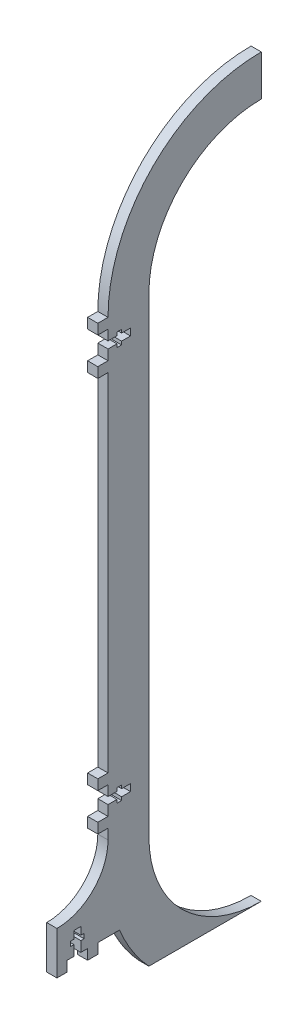
from build123d import *

# Parameters (mm, degrees)
BOSS_EXTRUDE2_DEPTH = 6.35


with BuildPart() as part:
    # Elevator Ball Support Rail → Boss-Extrude2 (new body)
    with BuildSketch(Plane(origin=(0, 0, 0), x_dir=(0, 0, -1), z_dir=(1, 0, 0))):
        with BuildLine():
            ThreePointArc((0, 146.05), (20.458591334, 195.441408666), (69.85, 215.9))
            Line((69.85, 215.9), (69.85, 241.3))
            ThreePointArc((69.85, 241.3), (2.498079092, 213.401920908), (-25.4, 146.05))
            Line((-25.4, 146.05), (-31.75, 146.05))
            Line((-31.75, 146.05), (-31.75, 139.7))
            Line((-31.75, 139.7), (-25.4, 139.7))
            Line((-25.4, 139.7), (-25.4, 133.35))
            Line((-25.4, 133.35), (-19.865000021, 133.35))
            Line((-19.865000021, 133.35), (-19.865000021, 135.390999982))
            Line((-19.865000021, 135.390999982), (-16.964999979, 135.390999982))
            Line((-16.964999979, 135.390999982), (-16.964999979, 133.35))
            Line((-16.964999979, 133.35), (-11.43, 133.35))
            Line((-11.43, 133.35), (-11.43, 129.032))
            Line((-11.43, 129.032), (-16.964999979, 129.032))
            Line((-16.964999979, 129.032), (-16.964999979, 126.991000018))
            Line((-16.964999979, 126.991000018), (-19.865000021, 126.991000018))
            Line((-19.865000021, 126.991000018), (-19.865000021, 129.032))
            Line((-19.865000021, 129.032), (-25.4, 129.032))
            Line((-25.4, 129.032), (-25.4, 122.682))
            Line((-25.4, 122.682), (-31.75, 122.682))
            Line((-31.75, 122.682), (-31.75, 116.332))
            Line((-31.75, 116.332), (-25.4, 116.332))
            Line((-25.4, 116.332), (-25.4, -99.187))
            Line((-25.4, -99.187), (-31.75, -99.187))
            Line((-31.75, -99.187), (-31.75, -105.537))
            Line((-31.75, -105.537), (-25.4, -105.537))
            Line((-25.4, -105.537), (-25.4, -111.887))
            Line((-25.4, -111.887), (-19.865000021, -111.887))
            Line((-19.865000021, -111.887), (-19.865000021, -109.846000018))
            Line((-19.865000021, -109.846000018), (-16.964999979, -109.846000018))
            Line((-16.964999979, -109.846000018), (-16.964999979, -111.887))
            Line((-16.964999979, -111.887), (-11.43, -111.887))
            Line((-11.43, -111.887), (-11.43, -116.205))
            Line((-11.43, -116.205), (-16.964999979, -116.205))
            Line((-16.964999979, -116.205), (-16.964999979, -118.245999982))
            Line((-16.964999979, -118.245999982), (-19.865000021, -118.245999982))
            Line((-19.865000021, -118.245999982), (-19.865000021, -116.205))
            Line((-19.865000021, -116.205), (-25.4, -116.205))
            Line((-25.4, -116.205), (-25.4, -122.555))
            Line((-25.4, -122.555), (-31.75, -122.555))
            Line((-31.75, -122.555), (-31.75, -128.905))
            Line((-31.75, -128.905), (-25.4, -128.905))
            Line((-25.4, -128.905), (-25.4, -135.255))
            ThreePointArc((-25.4, -135.255), (-34.699359697, -157.705640303), (-57.15, -167.005))
            Line((-57.15, -167.005), (-57.15, -193.675))
            Line((-57.15, -193.675), (-50.8, -193.675))
            Line((-50.8, -193.675), (-50.8, -187.325))
            Line((-50.8, -187.325), (-46.609, -187.325))
            Line((-46.609, -187.325), (-46.609, -180.975))
            Line((-46.609, -180.975), (-48.649999982, -180.975))
            Line((-48.649999982, -180.975), (-48.649999982, -178.074999958))
            Line((-48.649999982, -178.074999958), (-46.609, -178.074999958))
            Line((-46.609, -178.074999958), (-46.609, -173.355))
            Line((-46.609, -173.355), (-42.291, -173.355))
            Line((-42.291, -173.355), (-42.291, -178.074999958))
            Line((-42.291, -178.074999958), (-40.250000018, -178.074999958))
            Line((-40.250000018, -178.074999958), (-40.250000018, -180.975))
            Line((-40.250000018, -180.975), (-42.291, -180.975))
            Line((-42.291, -180.975), (-42.291, -187.325))
            Line((-42.291, -187.325), (-38.1, -187.325))
            Line((-38.1, -187.325), (-38.1, -193.675))
            Line((-38.1, -193.675), (-31.75, -193.675))
            Line((-31.75, -193.675), (-31.75, -187.325))
            Line((-31.75, -187.325), (-18.260077364, -187.325))
            ThreePointArc((-18.260077364, -187.325), (-10.411940959, -202.43166482), (0, -215.9))
            Line((0, -215.9), (69.85, -215.9))
            ThreePointArc((69.85, -215.9), (20.458591334, -195.441408666), (0, -146.05))
            Line((0, -146.05), (0, 146.05))
        make_face()
    extrude(amount=BOSS_EXTRUDE2_DEPTH)


solid = part.part
